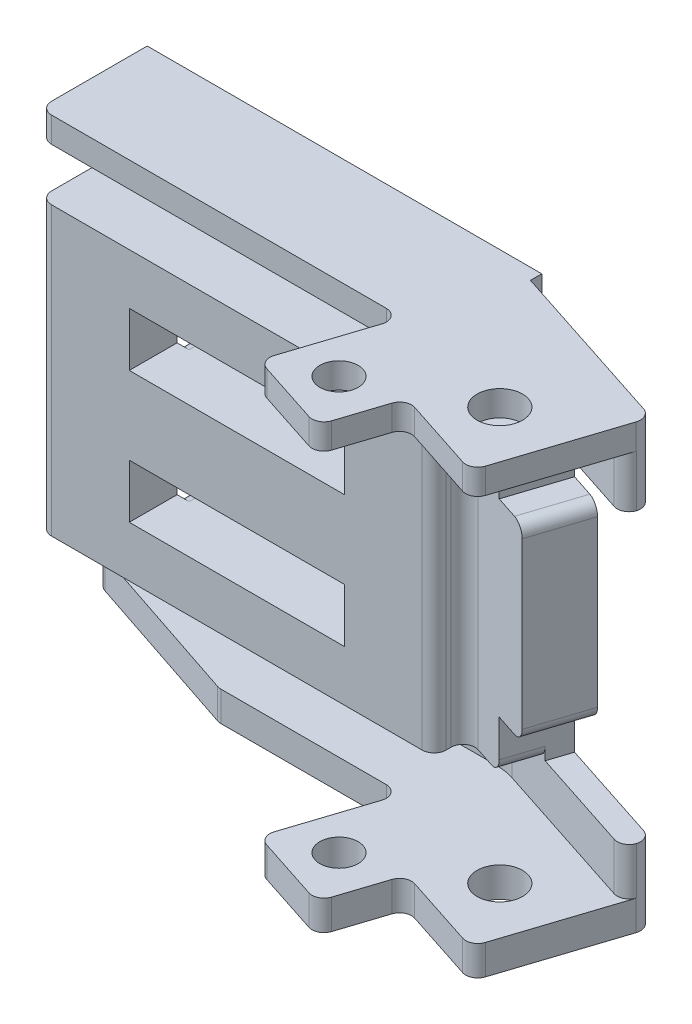
from build123d import *

# Parameters (mm, degrees)
EXTRUDE_1_DEPTH          = 1
EXTRUDE_2_DEPTH          = 2
EXTRUDE_2_DEPTH_BACK     = 1
SKETCH_2_W               = 33
SKETCH_2_H               = 35.000000000000014
SKETCH_3_W               = 33
SKETCH_3_H               = 35.000000000000014
EXTRUDE_3_DEPTH          = 6
SKETCH_7_W               = 33
SKETCH_7_H               = 4.000000000000002
CUT_EXTRUDE_5_DEPTH      = 6
EXTRUDE_5_DEPTH          = 24
EXTRUDE_6_REACH          = 45.767
EXTRUDE_7_DEPTH          = 5.5
SKETCH_14_W              = 15.119999999999994
SKETCH_14_H              = 1.500000000000007
EXTRUDE_8_DEPTH          = 3.049213514
CUT_EXTRUDE_8_DEPTH      = 2
CUT_EXTRUDE_8_DEPTH_BACK = 2
SKETCH_18_W              = 3.999999999999984
SKETCH_18_H              = 4
CUT_EXTRUDE_10_DEPTH     = 10
FILLET_1_R               = 5
EXTRUDE_9_DEPTH          = 1.125196054
EXTRUDE_10_DEPTH         = 1.5
SKETCH_22_R              = 1.8999999999999986
CUT_EXTRUDE_11_DEPTH     = 50.283293631156084
CUT_EXTRUDE_12_DEPTH     = 7
MOVE_FACE_1_BY           = 1
MOVE_FACE_2_BY           = 1
MOVE_START               = -18.5
MOVE_FACE_3_DEPTH        = 37
MOVE_FACE_3_2_DEPTH      = 6.5
MOVE_START_2             = 12
MOVE_FACE_3_3_DEPTH      = 6.5
MOVE_START_3             = -8
MOVE_FACE_3_4_DEPTH      = 16
EXTRUDE_11_DEPTH         = 2.125196054
EXTRUDE_12_DEPTH         = 2.5
SKETCH_27_R              = 1.6000000000000019
EXTRUDE_14_DEPTH         = 2.5
EXTRUDE_START            = -2.125196054
SKETCH_29_R              = 1.6000000000000019
EXTRUDE_15_DEPTH         = 2.125196054
MOVE_FACE_6_BY           = 1
MOVE_FACE_6_2_BY         = 1
CUT_EXTRUDE_13_DEPTH     = 2.5
MOVE_FACE_10_BY          = 1
SKETCH_31_W              = 30
SKETCH_31_H              = 21.900000000000002
CUT_EXTRUDE_14_DEPTH     = 2
FILLET_3_R               = 1
MOVE_FACE_4_BY           = 0.1
MOVE_FACE_4_2_BY         = 0.1
MOVE_FACE_5_BY           = 0.05
MOVE_FACE_5_2_BY         = 0.05
FILLET_4_R               = 1
FILLET_5_R               = 1


# Read off the part's stored shape, not the designer's step: 移动面3
with BuildPart() as part:
    # 草图1 → 凸台-拉伸1 (new body)
    with BuildSketch(Plane.XY):
        Polygon((15.000000000000005, -15.999999999999996), (-14.999999999999996, -16.000000000000004), (-14.999999999999996, 15.999999999999996), (15.000000000000004, 16), align=None)
        Polygon((9.000000000000004, 3.2500000000000013), (-8.999999999999996, 3.2499999999999987), (-8.999999999999995, 7.749999999999998), (9.000000000000005, 7.750000000000001), align=None, mode=Mode.SUBTRACT)
        Polygon((-8.999999999999996, -3.249999999999995), (-8.999999999999995, -7.749999999999995), (9.000000000000005, -7.749999999999997), (9.000000000000004, -3.249999999999998), align=None, mode=Mode.SUBTRACT)
    extrude(amount=EXTRUDE_1_DEPTH)

    # 草图2 → 凸台-拉伸2 (add, two sides: drawn at the far end of the back side and taken through both)
    with BuildSketch(Plane(origin=(0, 0, 0), x_dir=(-1, 0, 0), z_dir=(0, 0, -1)).offset(-EXTRUDE_2_DEPTH_BACK)):
        Rectangle(SKETCH_2_W, SKETCH_2_H)
        Polygon((14.999999999999996, -16.000000000000004), (14.999999999999996, 15.999999999999996), (-15.000000000000004, 16), (-15.000000000000005, -15.999999999999996), align=None, mode=Mode.SUBTRACT)
    extrude(amount=EXTRUDE_2_DEPTH + EXTRUDE_2_DEPTH_BACK)

    # 草图3 → 凸台-拉伸3 (add)
    with BuildSketch(Plane.XY.offset(1)):
        Rectangle(SKETCH_3_W, SKETCH_3_H)
        Polygon((-8.999999999999995, -7.749999999999995), (-8.999999999999996, -3.249999999999995), (9.000000000000004, -3.249999999999998), (9.000000000000005, -7.749999999999997), align=None, mode=Mode.SUBTRACT)
        Polygon((9.000000000000005, 7.750000000000001), (9.000000000000004, 3.2500000000000013), (-8.999999999999996, 3.2499999999999987), (-8.999999999999995, 7.749999999999998), align=None, mode=Mode.SUBTRACT)
    extrude(amount=EXTRUDE_3_DEPTH)

    # 草图7 → 切除-拉伸5 (cut)
    with BuildSketch(Plane.XY.offset(7)):
        Polygon((-16.5, 12.000000000000002), (16.5, 12.000000000000002), (16.499999999999996, 16.374803946020762), (-16.500000000000004, 16.374803946020762), align=None)
        with Locations((0, -14)):
            Rectangle(SKETCH_7_W, SKETCH_7_H)
    extrude(amount=-CUT_EXTRUDE_5_DEPTH, mode=Mode.SUBTRACT)

    # 草图9 → 凸台-拉伸5 (add)
    with BuildSketch(Plane(origin=(0, 12.000000000000002, 0), x_dir=(1, 0, 0), z_dir=(0, 1, 0))):
        Polygon((16.5, -4.207043388734913), (29.931102526972527, -8.584035071381752), (30.87589166823087, -5.684884069354349), (31.17048984690754, -4.78088912740533), (16.5, 0), (16.5, -1), align=None)
    extrude(amount=-EXTRUDE_5_DEPTH)

    # 凸台-拉伸6: up to this face of the body (flat: up to its plane)
    extrude_6_end = Plane(part.part.faces().sort_by_distance((0, 17.5, 2.5))[0])
    # 草图12 → 凸台-拉伸6 (add, up to the picked face)
    with BuildSketch(Plane(origin=(0, 12.000000000000002, 0), x_dir=(1, 0, 0), z_dir=(0, 1, 0)), mode=Mode.PRIVATE) as extrude_6_sk1:
        Polygon((16.5, -1), (30.87589166823087, -5.684884069354349), (31.17048984690754, -4.78088912740533), (16.5, 0), align=None)
    extrude_6_tool1 = split(extrude(extrude_6_sk1.sketch, amount=EXTRUDE_6_REACH, mode=Mode.PRIVATE), bisect_by=extrude_6_end, keep=Keep.BOTH, mode=Mode.PRIVATE)
    add(extrude_6_tool1.solids().sort_by(Axis((23.761844, 12, 2.864834), (0, 1, 0)))[0])

    # 草图13 → 凸台-拉伸7 (add)
    with BuildSketch(Plane.XZ.offset(11.999999999999998)):
        Polygon((16.5, 1), (16.5, 0), (31.17048984690754, 4.78088912740533), (30.87589166823087, 5.684884069354353), align=None)
    extrude(amount=EXTRUDE_7_DEPTH)

    # 草图14 → 凸台-拉伸8 (add)
    with BuildSketch(Plane(origin=(1.2894852791645197, 0, -3.9568750062159683), x_dir=(0.9507864859941054, 0, 0.3098468299837534), z_dir=(-0.3098468299837534, 0, 0.9507864859941054))):
        Polygon((15.997823848886494, 17.500000000000007), (31.11782384888649, 17.500000000000014), (31.11782384888649, 16.374803946020762), (15.997823848886494, 16.374803946020762), align=None)
        with Locations((23.557823848886493, -16.750000000000004)):
            Rectangle(SKETCH_14_W, SKETCH_14_H)
    extrude(amount=EXTRUDE_8_DEPTH)

    # 草图16 → 切除-拉伸8 (cut, two sides: drawn at the far end of the back side and taken through both)
    with BuildSketch(Plane(origin=(0, 0, 0), x_dir=(-1, 0, 0), z_dir=(0, 0, -1)).offset(-CUT_EXTRUDE_8_DEPTH_BACK)):
        Polygon((8.999999999999996, -7.749999999999995), (8.999999999999996, -11.249999999999995), (14.999999999999996, -11.249999999999998), (14.999999999999996, -7.749999999999995), (11.999999999999996, -7.749999999999995), (11.999999999999996, -3.2499999999999982), (14.999999999999996, -3.249999999999998), (14.999999999999996, 3.2499999999999987), (11.999999999999996, 3.2499999999999982), (11.999999999999996, 7.750000000000001), (14.999999999999996, 7.750000000000001), (14.999999999999996, 10.950000000000001), (8.999999999999998, 10.950000000000001), (8.999999999999998, 7.749999999999998), (8.999999999999996, 3.2499999999999982), (8.999999999999996, -3.2499999999999947), align=None)
        Polygon((11.999999999999996, 3.2499999999999982), (14.999999999999996, 3.2499999999999987), (14.999999999999996, 7.75), (11.999999999999996, 7.750000000000001), align=None)
        Polygon((11.999999999999996, -7.749999999999995), (14.999999999999996, -7.749999999999995), (14.999999999999996, -3.2499999999999982), (11.999999999999996, -3.249999999999998), align=None)
        Polygon((14.999999999999996, -7.749999999999995), (14.999999999999996, -11.249999999999998), (16.500000000000004, -11.249999999999995), (16.5, 10.950000000000001), (14.999999999999996, 10.950000000000001), (14.999999999999996, 7.750000000000001), (14.999999999999996, 3.25), (14.999999999999996, -3.249999999999998), align=None)
    extrude(amount=CUT_EXTRUDE_8_DEPTH + CUT_EXTRUDE_8_DEPTH_BACK, mode=Mode.SUBTRACT)

    # 草图18 → 切除-拉伸10 (cut)
    with BuildSketch(Plane(origin=(29.586406389066333, 0, 9.641759075570365), x_dir=(0.3098468299837543, 0, -0.9507864859941051), z_dir=(0.9507864859941051, 0, 0.3098468299837543))):
        Polygon((1.1124726947319783, 12.000000000000002), (5.112472694731979, 12.000000000000002), (5.112472694731981, 8.000000000000002), (1.11247269473198, 8), align=None)
        with Locations((3.112472694731972, -9.999999999999996)):
            Rectangle(SKETCH_18_W, SKETCH_18_H)
    extrude(amount=-CUT_EXTRUDE_10_DEPTH, mode=Mode.SUBTRACT)

    # 圆角1
    fillet_1_edges = [part.edges().sort_by_distance(p)[0] for p in [
        (16.5, 14.187401973010381, 1),
        (16.5, -14, 1),
    ]]
    fillet(fillet_1_edges, radius=FILLET_1_R)

    # 草图20 → 凸台-拉伸9 (add)
    with BuildSketch(Plane(origin=(0, 17.500000000000007, 0), x_dir=(1, 0, 0), z_dir=(0, 1, 0))):
        Polygon((29.93110252697253, -8.584035071381752), (19.47245118103737, -5.175719941560464), (17.303523371151098, -11.831225343519213), (27.762174717086257, -15.239540473340492), align=None)
    extrude(amount=-EXTRUDE_9_DEPTH)

    # 草图23 → 凸台-拉伸10 (add)
    with BuildSketch(Plane.XZ.offset(17.500000000000007)):
        Polygon((19.47245118103737, 5.175719941560467), (17.303523371151098, 11.831225343519213), (27.762174717086257, 15.239540473340492), (29.931102526972523, 8.584035071381754), align=None)
    extrude(amount=-EXTRUDE_10_DEPTH)

    # 草图22 → 切除-拉伸11 (cut, through all)
    with BuildSketch(Plane(origin=(0, 17.500000000000007, 0), x_dir=(1, 0, 0), z_dir=(0, 1, 0))):
        with Locations(Location((24.402553022042618, -9.411767136448253, 0), (0, 0, 270))):
            Circle(SKETCH_22_R)
    extrude(amount=-CUT_EXTRUDE_11_DEPTH, mode=Mode.SUBTRACT)

    # 草图24 → 切除-拉伸12 (cut)
    with BuildSketch(Plane(origin=(29.586406389066333, 0, 9.64175907557036), x_dir=(0.30984682998375473, 0, -0.9507864859941049), z_dir=(0.9507864859941049, 0, 0.30984682998375473))):
        Polygon((5.112472694731976, 8.000000000000002), (1.1124726947319747, 8), (1.1124726947319747, -7.9999999999999964), (5.112472694731961, -7.9999999999999964), align=None)
    extrude(amount=-CUT_EXTRUDE_12_DEPTH, mode=Mode.SUBTRACT)

    # Move Face 1: a face moved outward by 1.0
    extrude(part.faces().sort_by_distance((6.953272881, -17.5, 3.982460296))[0], amount=MOVE_FACE_1_BY, dir=(0, -1, 0))

    # Move Face 2: a face moved outward by 1.0
    extrude(part.faces().sort_by_distance((6.953272881, 17.5, 3.982460296))[0], amount=MOVE_FACE_2_BY, dir=(0, 1, 0))

    # Move Face 3 outline → Move Face 3 (add)
    with BuildSketch(Plane(origin=(0, 0, 0), x_dir=(1, 0, 0), z_dir=(0, 1, 0)).offset(MOVE_START)):
        Polygon((21.662624987, -1.682420828), (21.972471817, -0.731634342), (16.5, 1.051760847), (16.5, 0), align=None)
    extrude(amount=MOVE_FACE_3_DEPTH)

    # Move Face 3 2 outline → Move Face 3 2 (add)
    with BuildSketch(Plane(origin=(0, 0, 0), x_dir=(1, 0, 0), z_dir=(0, 1, 0)).offset(MOVE_START)):
        Polygon((31.170489847, -4.780889127), (31.480336677, -3.830102641), (21.972471817, -0.731634342), (21.662624987, -1.682420828), align=None)
    extrude(amount=MOVE_FACE_3_2_DEPTH)

    # Move Face 3 3 outline → Move Face 3 3 (add)
    with BuildSketch(Plane(origin=(0, 0, 0), x_dir=(1, 0, 0), z_dir=(0, 1, 0)).offset(MOVE_START_2)):
        Polygon((31.170489847, -4.780889127), (31.480336677, -3.830102641), (21.972471817, -0.731634342), (21.662624987, -1.682420828), align=None)
    extrude(amount=MOVE_FACE_3_3_DEPTH)

    # Move Face 3 4 outline → Move Face 3 4 (add)
    with BuildSketch(Plane(origin=(0, 0, 0), x_dir=(1, 0, 0), z_dir=(0, 1, 0)).offset(MOVE_START_3)):
        Polygon((24.514984445, -2.611961318), (24.824831275, -1.661174832), (21.972471817, -0.731634342), (21.662624987, -1.682420828), align=None)
    extrude(amount=MOVE_FACE_3_4_DEPTH)

    # 草图25 → 凸台-拉伸11 (add)
    with BuildSketch(Plane(origin=(0, 18.50000000000001, 0), x_dir=(1, 0, 0), z_dir=(0, 1, 0))):
        Polygon((19.47245118103737, -5.175719941560464), (17.303523371151098, -11.831225343519213), (15.153872120915374, -11.130686752292034), (16.5, -7), (16.5, -4.207043388734913), align=None)
    extrude(amount=-EXTRUDE_11_DEPTH)

    # 草图26 → 凸台-拉伸12 (add)
    with BuildSketch(Plane.XZ.offset(18.50000000000001)):
        Polygon((16.5, 4.207043388734913), (19.47245118103737, 5.175719941560467), (17.303523371151098, 11.831225343519213), (15.153872120915374, 11.130686752292034), (16.5, 7), align=None)
    extrude(amount=-EXTRUDE_12_DEPTH)

    # 草图27 → 凸台-拉伸14 (add)
    with BuildSketch(Plane.XZ.offset(18.50000000000001)):
        Polygon((13.29479114101286, 16.835405668256666), (10.917824926027595, 16.060788593297282), (13.870597882040693, 7), (16.5, 7), (15.153872120915374, 11.130686752292034), (18.957018064891795, 12.370074072227043), (17.09793708498928, 18.074792988191682), align=None)
        with Locations(Location((15.448533090379124, 13.90870243322237, 0), (0, 0, 270))):
            Circle(SKETCH_27_R, mode=Mode.SUBTRACT)
    extrude(amount=-EXTRUDE_14_DEPTH)

    # 草图29 → 凸台-拉伸15 (add)
    with BuildSketch(Plane(origin=(0, 18.50000000000001, 0), x_dir=(1, 0, 0), z_dir=(0, 1, 0)).offset(EXTRUDE_START)):
        Polygon((16.5, -7), (13.870597882040684, -7.000000000000003), (10.917824926027592, -16.060788593297286), (17.09793708498928, -18.074792988191682), (18.957018064891795, -12.370074072227045), (15.153872120915374, -11.130686752292034), align=None)
        with Locations(Location((15.448533090379124, -13.90870243322237, 0), (0, 0, 90))):
            Circle(SKETCH_29_R, mode=Mode.SUBTRACT)
    extrude(amount=EXTRUDE_15_DEPTH)

    # Move Face 6: a face moved outward by 1.0
    extrude(part.faces().sort_by_distance((18.027477575, 17.437401973, 15.22243353))[0], amount=MOVE_FACE_6_BY, dir=(0.950786486, 0, 0.30984683))

    # Move Face 6 2: a face moved outward by 1.0
    extrude(part.faces().sort_by_distance((18.027477575, -17.25, 15.22243353))[0], amount=MOVE_FACE_6_2_BY, dir=(0.950786486, 0, 0.30984683))

    # 草图30 → 切除-拉伸13 (cut)
    with BuildSketch(Plane.XZ.offset(18.50000000000001)):
        Polygon((-16.5, 2), (-1.5000000000000013, 7), (-16.5, 7), align=None)
    extrude(amount=-CUT_EXTRUDE_13_DEPTH, mode=Mode.SUBTRACT)

    # Move Face 10: a face moved inward by 1.0
    extrude(part.faces().sort_by_distance((-12.75, -0.15, 2))[0], amount=MOVE_FACE_10_BY, dir=(0, 0, 1), mode=Mode.SUBTRACT)

    # 草图31 → 切除-拉伸14 (cut)
    with BuildSketch(Plane(origin=(0, 0, 0), x_dir=(-1, 0, 0), z_dir=(0, 0, -1))):
        Rectangle(SKETCH_31_W, SKETCH_31_H)
    extrude(amount=-CUT_EXTRUDE_14_DEPTH, mode=Mode.SUBTRACT)

    # 圆角3
    # the kernel refuses this fillet: 1 mm, written as the material it adds along each edge
    with BuildSketch(Plane(origin=(16.5, 12.000000000000002, 4.207043388734913), x_dir=(0, 0, 1), z_dir=(0, -1, 0))) as fillet_3_piece_1:
        with BuildLine():
            CenterArc((FILLET_3_R * 1.37764561158, -FILLET_3_R), FILLET_3_R, 90, 108.04999999999995)
            Line((FILLET_3_R * 0.426859125591, -FILLET_3_R * 1.30984682998), (0, 0))
            Line((0, 0), (FILLET_3_R * 1.37764561158, 0))
        make_face()
    extrude(amount=24)
    with BuildSketch(Plane(origin=(13.870597882040693, -18.50000000000001, 7), x_dir=(-0.3098468299837539, 0, 0.9507864859941051), z_dir=(0, 1, 0))) as fillet_3_piece_2:
        with BuildLine():
            CenterArc((FILLET_3_R * 1.37764561158, -FILLET_3_R), FILLET_3_R, 89.99999999999999, 108.04999999999978)
            Line((FILLET_3_R * 0.426859125591, -FILLET_3_R * 1.30984682998), (0, 0))
            Line((0, 0), (FILLET_3_R * 1.37764561158, -3e-17))
        make_face()
    extrude(amount=2.5)
    with BuildSketch(Plane(origin=(19.907804550891793, -18.50000000000001, 12.679920902227042), x_dir=(0.9507864859983255, 0, 0.3098468299708036), z_dir=(0, 1, 0))) as fillet_3_piece_3:
        with BuildLine():
            CenterArc((FILLET_3_R, -FILLET_3_R), FILLET_3_R, 89.99999999921975, 90.00000000000004)
            Line((-1.362018e-11, -FILLET_3_R), (0, 0))
            Line((0, 0), (FILLET_3_R, -4e-17))
        make_face()
    extrude(amount=2.5)
    with BuildSketch(Plane(origin=(19.907804550891793, 16.37480394600001, 12.679920902227044), x_dir=(-0.3098468299837508, 0, 0.9507864859941062), z_dir=(0, 1, 0))) as fillet_3_piece_4:
        with BuildLine():
            CenterArc((FILLET_3_R, FILLET_3_R), FILLET_3_R, 179.99999999999997, 89.99999999999989)
            Line((-1.361734e-11, FILLET_3_R), (0, 0))
            Line((0, 0), (FILLET_3_R, -4e-17))
        make_face()
    extrude(amount=2.125196054)
    with BuildSketch(Plane(origin=(13.870597882040684, 16.37480394600001, 7.000000000000003), x_dir=(-0.30984682998375257, 0, 0.9507864859941055), z_dir=(0, 1, 0))) as fillet_3_piece_5:
        with BuildLine():
            CenterArc((FILLET_3_R * 1.37764561158, -FILLET_3_R), FILLET_3_R, 89.99999999999997, 108.04999999999961)
            Line((FILLET_3_R * 0.426859125591, -FILLET_3_R * 1.30984682998), (0, 0))
            Line((0, 0), (FILLET_3_R * 1.37764561158, 0))
        make_face()
    extrude(amount=2.125196054)
    # the kernel refuses this fillet: 1 mm, written as the material it takes off along each edge
    with BuildSketch(Plane(origin=(16.5, -14.499999999999998, 7), x_dir=(-1, 0, 0), z_dir=(0, 1, 0))) as fillet_3_2_piece_1:
        with BuildLine():
            CenterArc((FILLET_3_R, -FILLET_3_R), FILLET_3_R, 90, 90)
            Line((0, -FILLET_3_R), (0, 0))
            Line((0, 0), (FILLET_3_R, 0))
        make_face()
    extrude(amount=29, mode=Mode.SUBTRACT)
    with BuildSketch(Plane(origin=(-16.5, 14.500000000000002, 7), x_dir=(0, 0, -1), z_dir=(0, -1, 0))) as fillet_3_2_piece_2:
        with BuildLine():
            CenterArc((FILLET_3_R, FILLET_3_R), FILLET_3_R, 180, 90)
            Line((0, FILLET_3_R), (0, 0))
            Line((0, 0), (FILLET_3_R, 0))
        make_face()
    extrude(amount=29, mode=Mode.SUBTRACT)
    with BuildSketch(Plane(origin=(-16.500000000000004, 16.374803946020762, 1), x_dir=(1, 8.1e-16, 0), z_dir=(8.1e-16, -1, 0))) as fillet_3_2_piece_3:
        with BuildLine():
            CenterArc((FILLET_3_R, -FILLET_3_R), FILLET_3_R, 90, 90)
            Line((0, -FILLET_3_R), (0, 0))
            Line((0, 0), (FILLET_3_R, 0))
        make_face()
    extrude(amount=4.37480394602076, mode=Mode.SUBTRACT)
    with BuildSketch(Plane(origin=(-16.5, -11.999999999999998, 1), x_dir=(1, 0, 0), z_dir=(0, -1, 0))) as fillet_3_2_piece_4:
        with BuildLine():
            CenterArc((FILLET_3_R, -FILLET_3_R), FILLET_3_R, 90, 90)
            Line((0, -FILLET_3_R), (0, 0))
            Line((0, 0), (FILLET_3_R, 0))
        make_face()
    extrude(amount=4.000000000000002, mode=Mode.SUBTRACT)
    with BuildSketch(Plane(origin=(31.480336677, -21.000000000237698, 3.830102641), x_dir=(-0.9507864860193448, 0, -0.3098468299063047), z_dir=(0, 1, 0))) as fillet_3_2_piece_5:
        with BuildLine():
            CenterArc((FILLET_3_R, FILLET_3_R), FILLET_3_R, 179.99999999455238, 90.00000000544753)
            Line((9.508169e-11, FILLET_3_R), (0, 0))
            Line((0, 0), (FILLET_3_R, -4e-17))
        make_face()
    extrude(amount=11.500000000475397, mode=Mode.SUBTRACT)
    with BuildSketch(Plane(origin=(-12.499999999999996, -11.249999999999995, -2), x_dir=(0, -1, 0), z_dir=(-1, 0, 0))) as fillet_3_2_piece_6:
        with BuildLine():
            CenterArc((FILLET_3_R, FILLET_3_R), FILLET_3_R, 180, 90)
            Line((0, FILLET_3_R), (0, 0))
            Line((0, 0), (FILLET_3_R, 0))
        make_face()
    extrude(amount=6.500000000000007, mode=Mode.SUBTRACT)
    with BuildSketch(Plane(origin=(-8.999999999999996, -7.749999999999995, 3), x_dir=(1, 0, 5.9e-16), z_dir=(5.9e-16, 0, -1))) as fillet_3_2_piece_7:
        with BuildLine():
            CenterArc((FILLET_3_R, FILLET_3_R), FILLET_3_R, 179.9999999999999, 90.00000000000011)
            Line((0, FILLET_3_R), (0, 0))
            Line((0, 0), (FILLET_3_R, 0))
        make_face()
    extrude(amount=3.5000000000000044, mode=Mode.SUBTRACT)
    with BuildSketch(Plane(origin=(-12.499999999999996, 10.950000000000001, -2), x_dir=(0, 1, 0), z_dir=(-1, 0, 0))) as fillet_3_2_piece_8:
        with BuildLine():
            CenterArc((FILLET_3_R, -FILLET_3_R), FILLET_3_R, 90, 90)
            Line((0, -FILLET_3_R), (0, 0))
            Line((0, 0), (FILLET_3_R, 0))
        make_face()
    extrude(amount=6.5000000000000036, mode=Mode.SUBTRACT)
    with BuildSketch(Plane(origin=(-16.500000000000004, -11.249999999999995, 3), x_dir=(1, -1.6e-16, 0), z_dir=(1.6e-16, 1, 0))) as fillet_3_2_piece_9:
        with BuildLine():
            CenterArc((FILLET_3_R, -FILLET_3_R), FILLET_3_R, 90, 90)
            Line((0, -FILLET_3_R), (0, 0))
            Line((0, 0), (FILLET_3_R, 0))
        make_face()
    extrude(amount=22.199999999999996, mode=Mode.SUBTRACT)
    with BuildSketch(Plane(origin=(31.48033667702287, 9.499999999796358, 3.8301026410074526), x_dir=(-0.9507864860193447, 0, -0.3098468299063047), z_dir=(0, 1, 0))) as fillet_3_2_piece_10:
        with BuildLine():
            CenterArc((FILLET_3_R, FILLET_3_R), FILLET_3_R, 179.99999999533287, 90.00000000466707)
            Line((8.145458e-11, FILLET_3_R), (0, 0))
            Line((0, 0), (FILLET_3_R, 3e-17))
        make_face()
    extrude(amount=11.500000000407283, mode=Mode.SUBTRACT)
    with BuildSketch(Plane(origin=(27.76217471708626, 21.00000000000001, 15.239540473340494), x_dir=(0.30984682998375185, 0, -0.9507864859941059), z_dir=(0, -1, 0))) as fillet_3_2_piece_11:
        with BuildLine():
            CenterArc((FILLET_3_R, -FILLET_3_R), FILLET_3_R, 90, 90.00000000000017)
            Line((-1.11e-15, -FILLET_3_R), (0, 0))
            Line((0, 0), (FILLET_3_R, -3e-17))
        make_face()
    extrude(amount=7.125196054000007, mode=Mode.SUBTRACT)
    with BuildSketch(Plane(origin=(27.76217471708626, -13.500000000000005, 15.239540473340494), x_dir=(0.30984682998375185, 0, -0.9507864859941059), z_dir=(0, -1, 0))) as fillet_3_2_piece_12:
        with BuildLine():
            CenterArc((FILLET_3_R, -FILLET_3_R), FILLET_3_R, 90, 90.00000000000017)
            Line((-1.11e-15, -FILLET_3_R), (0, 0))
            Line((0, 0), (FILLET_3_R, -3e-17))
        make_face()
    extrude(amount=7.500000000000007, mode=Mode.SUBTRACT)
    with BuildSketch(Plane(origin=(18.048723570989278, -21.000000000034067, 18.384639818191683), x_dir=(0.30984682998375124, 0, -0.950786485994106), z_dir=(0, 1, 0))) as fillet_3_2_piece_13:
        with BuildLine():
            CenterArc((FILLET_3_R, FILLET_3_R), FILLET_3_R, 179.99999999921968, 90.00000000078029)
            Line((1.362118e-11, FILLET_3_R), (0, 0))
            Line((0, 0), (FILLET_3_R, 0))
        make_face()
    extrude(amount=7.500000000068111, mode=Mode.SUBTRACT)
    with BuildSketch(Plane(origin=(10.917824926027595, -21.000000000000014, 16.060788593297282), x_dir=(0.950786485994105, 0, 0.3098468299837545), z_dir=(0, 1, 0))) as fillet_3_2_piece_14:
        with BuildLine():
            CenterArc((FILLET_3_R, FILLET_3_R), FILLET_3_R, 179.99999999999997, 90.00000000000011)
            Line((0, FILLET_3_R), (0, 0))
            Line((0, 0), (FILLET_3_R, 0))
        make_face()
    extrude(amount=7.500000000000007, mode=Mode.SUBTRACT)
    with BuildSketch(Plane(origin=(18.0487235709935, 13.874803945965944, 18.384639818178734), x_dir=(0.3098468299837508, 0, -0.9507864859941063), z_dir=(0, 1, 0))) as fillet_3_2_piece_15:
        with BuildLine():
            CenterArc((FILLET_3_R, FILLET_3_R), FILLET_3_R, 179.99999999999994, 90)
            Line((4.52e-15, FILLET_3_R), (0, 0))
            Line((0, 0), (FILLET_3_R, -4e-17))
        make_face()
    extrude(amount=7.125196054068134, mode=Mode.SUBTRACT)
    with BuildSketch(Plane(origin=(10.917824926027592, 13.874803946000004, 16.060788593297286), x_dir=(0.950786485994106, 0, 0.3098468299837513), z_dir=(0, 1, 0))) as fillet_3_2_piece_16:
        with BuildLine():
            CenterArc((FILLET_3_R, FILLET_3_R), FILLET_3_R, 179.9999999999999, 90)
            Line((1.12e-15, FILLET_3_R), (0, 0))
            Line((0, 0), (FILLET_3_R, 2e-17))
        make_face()
    extrude(amount=7.125196054000014, mode=Mode.SUBTRACT)
    with BuildSketch(Plane(origin=(-16.5, -20.301898050140334, 2), x_dir=(0.948683298050514, 0, 0.31622776601683716), z_dir=(0, 1, 0))) as fillet_3_2_piece_17:
        with BuildLine():
            CenterArc((FILLET_3_R * 0.720759220056, FILLET_3_R), FILLET_3_R, 198.43494882292194, 71.56505117707798)
            Line((-FILLET_3_R * 0.227924077994, FILLET_3_R * 0.683772233983), (0, 0))
            Line((0, 0), (FILLET_3_R * 0.720759220056, 0))
        make_face()
    extrude(amount=6.103796100280647, mode=Mode.SUBTRACT)
    with BuildSketch(Plane(origin=(-1.5000000000000036, -18.90569415042096, 7), x_dir=(1, 0, 0), z_dir=(0, 1, 0))) as fillet_3_2_piece_18:
        with BuildLine():
            CenterArc((FILLET_3_R * 0.162277660168, FILLET_3_R), FILLET_3_R, 251.56505117707798, 18.434948822922024)
            Line((-FILLET_3_R * 0.153950105848, FILLET_3_R * 0.0513167019495), (0, 0))
            Line((0, 0), (FILLET_3_R * 0.162277660168, 0))
        make_face()
    extrude(amount=3.311388300841898, mode=Mode.SUBTRACT)
    with BuildSketch(Plane(origin=(-8.999999999999998, 7.749999999999998, -0.5), x_dir=(0, 1, 0), z_dir=(0, 0, 1))) as fillet_3_2_piece_19:
        with BuildLine():
            CenterArc((FILLET_3_R, -FILLET_3_R), FILLET_3_R, 90, 89.99999999999994)
            Line((0, -FILLET_3_R), (0, 0))
            Line((0, 0), (FILLET_3_R, 0))
        make_face()
    extrude(amount=3.5, mode=Mode.SUBTRACT)
    with BuildSketch(Plane(origin=(-16.5, 13.874803946020762, 7), x_dir=(1, -1.67e-15, 0), z_dir=(1.67e-15, 1, 0))) as fillet_3_2_piece_20:
        with BuildLine():
            CenterArc((FILLET_3_R, FILLET_3_R), FILLET_3_R, 180, 90)
            Line((0, FILLET_3_R), (0, 0))
            Line((0, 0), (FILLET_3_R, 0))
        make_face()
    extrude(amount=7.125196053979245, mode=Mode.SUBTRACT)
    with BuildSketch(Plane(origin=(30.87589166823087, 9.499999999999993, 5.684884069354348), x_dir=(0.309846829983754, 0, -0.9507864859941052), z_dir=(0, 1, 0))) as fillet_3_2_piece_21:
        with BuildLine():
            CenterArc((FILLET_3_R, FILLET_3_R), FILLET_3_R, 179.99999999999974, 90.00000000000034)
            Line((8.5e-16, FILLET_3_R), (0, 0))
            Line((0, 0), (FILLET_3_R, 2e-17))
        make_face()
    extrude(amount=6.874803946020769, mode=Mode.SUBTRACT)
    with BuildSketch(Plane(origin=(30.87589166823087, -9.499999999999991, 5.684884069354353), x_dir=(0.3098468299837505, 0, -0.9507864859941063), z_dir=(0, -1, 0))) as fillet_3_2_piece_22:
        with BuildLine():
            CenterArc((FILLET_3_R, -FILLET_3_R), FILLET_3_R, 90.00000000000013, 90.00000000000011)
            Line((4.47e-15, -FILLET_3_R), (0, 0))
            Line((0, 0), (FILLET_3_R, 3e-17))
        make_face()
    extrude(amount=6.500000000000011, mode=Mode.SUBTRACT)

    # Move Face 4: a face moved inward by 0.1
    extrude(part.faces().sort_by_distance((22.624034471, 8, 3.573370802))[0], amount=MOVE_FACE_4_BY, dir=(0, -1, 0), mode=Mode.SUBTRACT)

    # Move Face 4 2: a face moved inward by 0.1
    extrude(part.faces().sort_by_distance((22.624034471, -8, 3.573370802))[0], amount=MOVE_FACE_4_2_BY, dir=(0, 1, 0), mode=Mode.SUBTRACT)

    # Move Face 5: a face moved inward by 0.05
    extrude(part.faces().sort_by_distance((26.322013729, 12, 3.174964207))[0], amount=MOVE_FACE_5_BY, dir=(0, 1, 0), mode=Mode.SUBTRACT)

    # Move Face 5 2: a face moved inward by 0.05
    extrude(part.faces().sort_by_distance((26.322013729, -12, 3.174964207))[0], amount=MOVE_FACE_5_2_BY, dir=(0, -1, 0), mode=Mode.SUBTRACT)

    # 圆角4
    fillet_4_edges = [part.edges().sort_by_distance(p)[0] for p in [
        (20.895632237660646, 12.000000000000002, 4.035991270530513),
        (20.895632237660646, -11.999999999999996, 4.035991270530514),
        (23.895290784981295, -7.899999999999997, 4.513534289507266),
        (23.895290784981295, 7.9, 4.513534289507259),
    ]]
    fillet(fillet_4_edges, radius=FILLET_4_R)

    # 圆角5
    fillet_5_edges = [part.edges().sort_by_distance(p)[0] for p in [
        (-8.999999999999996, 3.2499999999999982, 2.5),
        (-8.999999999999996, -3.2499999999999947, 2.5),
    ]]
    fillet(fillet_5_edges, radius=FILLET_5_R)


solid = part.part
